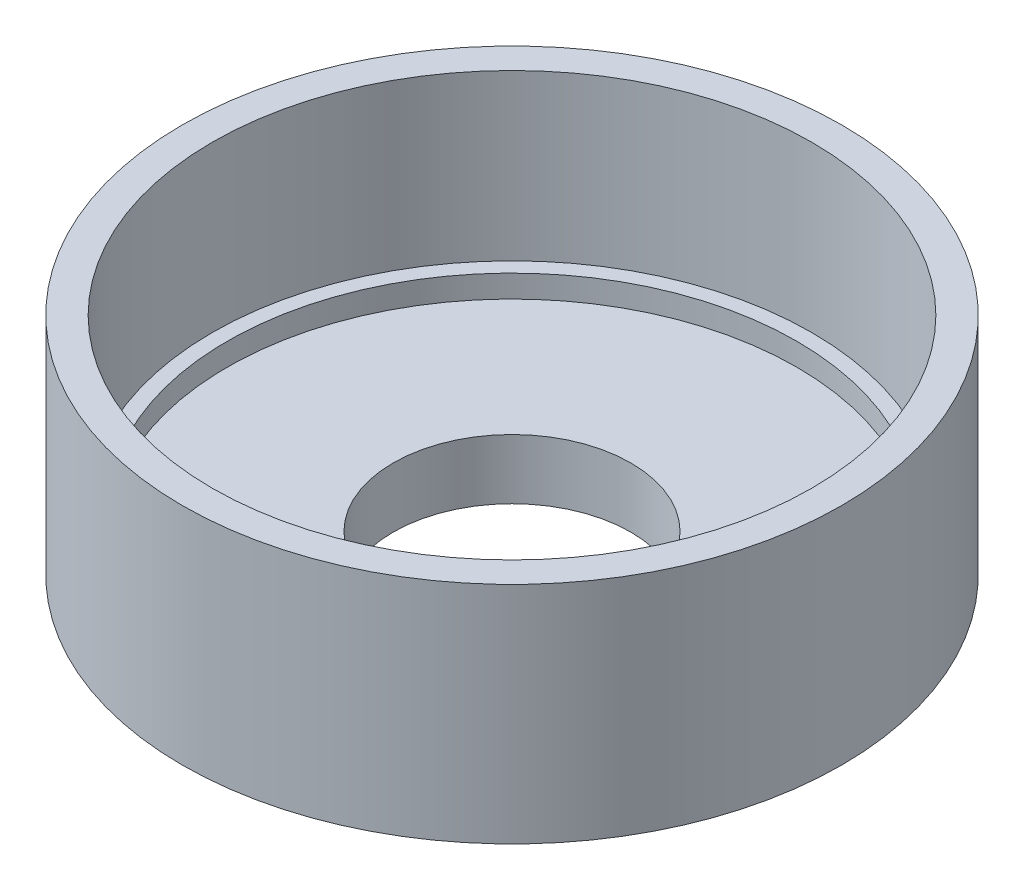
from build123d import *

# Parameters (mm, degrees)
SKETCH1_R           = 22
SKETCH1_R_2         = 7.93
BOSS_EXTRUDE1_DEPTH = 4
BOSS_EXTRUDE2_START = 11
SKETCH1_3_R         = 22
SKETCH1_3_R_2       = 20
BOSS_EXTRUDE2_DEPTH = 11
SKETCH1_4_R         = 19
CUT_EXTRUDE1_DEPTH  = 1.5
SKETCH3_R           = 11
SKETCH3_R_2         = 7.93
BOSS_EXTRUDE3_DEPTH = 1.5
CHAMFER1_SIZE       = 2.5


with BuildPart() as part:
    # Sketch1 → Boss-Extrude1 (new body)
    with BuildSketch(Plane(origin=(0, 0, 0), x_dir=(1, 0, 0), z_dir=(0, 1, 0))):
        with Locations(Location((0, 0, 0), (0, 0, 270))):
            Circle(SKETCH1_R)
        with Locations(Location((0, 0, 0), (0, 0, 270))):
            Circle(SKETCH1_R_2, mode=Mode.SUBTRACT)
    extrude(amount=-BOSS_EXTRUDE1_DEPTH)

    # Sketch1<3> → Boss-Extrude2 (add)
    with BuildSketch(Plane(origin=(0, 0, 0), x_dir=(1, 0, 0), z_dir=(0, 1, 0)).offset(BOSS_EXTRUDE2_START)):
        with Locations(Location((0, 0, 0), (0, 0, 270))):
            Circle(SKETCH1_3_R)
        with Locations(Location((0, 0, 0), (0, 0, 270))):
            Circle(SKETCH1_3_R_2, mode=Mode.SUBTRACT)
    extrude(amount=-BOSS_EXTRUDE2_DEPTH)

    # Sketch1<4> → Cut-Extrude1 (cut)
    with BuildSketch(Plane(origin=(0, 0, 0), x_dir=(1, 0, 0), z_dir=(0, 1, 0))):
        with Locations(Location((0, 0, 0), (0, 0, 270))):
            Circle(SKETCH1_4_R)
    extrude(amount=-CUT_EXTRUDE1_DEPTH, mode=Mode.SUBTRACT)

    # Sketch3 → Boss-Extrude3 (add)
    with BuildSketch(Plane.XZ.offset(4)):
        with Locations(Location((0, 0, 0), (0, 0, 90))):
            Circle(SKETCH3_R)
        with Locations(Location((0, 0, 0), (0, 0, 90))):
            Circle(SKETCH3_R_2, mode=Mode.SUBTRACT)
    extrude(amount=BOSS_EXTRUDE3_DEPTH)

    # Chamfer1
    # the kernel refuses this chamfer: 2.5 mm, written as the material it takes off along each edge
    with BuildSketch(Plane(origin=(0, -5.5, 0), x_dir=(0, 0, 1), z_dir=(1, 0, 0))) as chamfer1_piece_1_section:
        Polygon((11 - CHAMFER1_SIZE, 0), (11, -CHAMFER1_SIZE), (11, 0), align=None)
    chamfer1_piece_1 = revolve(axis=Axis((0, -5.5, 0), (0, -1, 0)), mode=Mode.PRIVATE)
    chamfer1_piece_1 = split(chamfer1_piece_1, bisect_by=Plane(origin=(0, -4, -9.254586784), z_dir=(0, -1, 0)), keep=Keep.TOP, mode=Mode.PRIVATE)
    add(chamfer1_piece_1, mode=Mode.SUBTRACT)


solid = part.part
